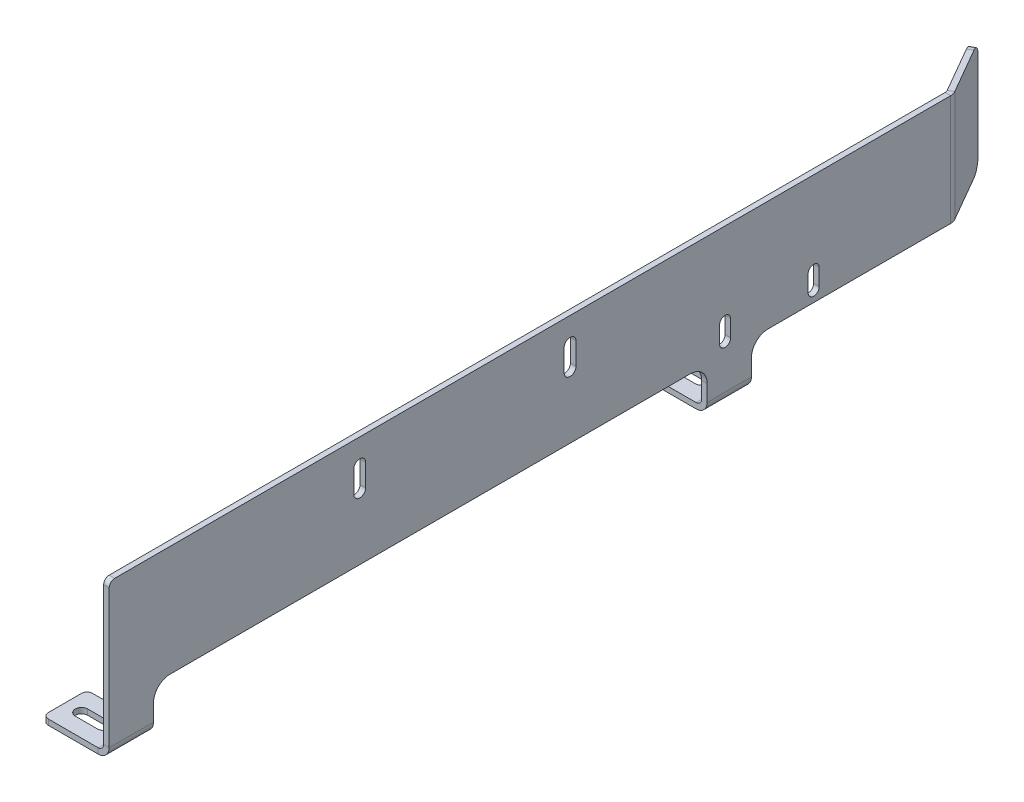
from build123d import *

# Parameters (mm, degrees)
BASE_FLANGE1_DEPTH             = 241.3
SKETCH7_W                      = 38.1
SKETCH7_H                      = 114.3
CUT_EXTRUDE2_DEPTH             = 25.4
EDGE_FLANGE1_DEPTH             = 63.5
FILLET2_R                      = 6.35
F_3_16_0_1875_DIAMETER_HOLE2_D = 4.7625
CUT_EXTRUDE1_REACH             = 293.504
CUT_EXTRUDE3_REACH             = 294.454
CUT_EXTRUDE4_REACH             = 294.454
SKETCH12_W                     = 317.5
SKETCH12_H                     = 25.4
FILLET1_R                      = 3.175
FILLET3_R                      = 9.525
CUT_EXTRUDE5_REACH             = 294.057


# Sheet-metal steps are written as plain solids
with BuildPart() as part:
    # Sketch1 → Base-Flange1 (new, symmetric)
    with BuildSketch(Plane.XY):
        with BuildLine():
            Line((0, 88.9), (0, 6.35))
            ThreePointArc((0, 6.35), (-1.859871939, 1.859871939), (-6.35, 0))
            Line((-6.35, 0), (-38.1, 0))
            Line((-38.1, 0), (-38.1, 3.175))
            Line((-38.1, 3.175), (-6.35, 3.175))
            ThreePointArc((-6.35, 3.175), (-4.10493597, 4.10493597), (-3.175, 6.35))
            Line((-3.175, 6.35), (-3.175, 88.9))
            Line((-3.175, 88.9), (0, 88.9))
        make_face()
    extrude(amount=BASE_FLANGE1_DEPTH, both=True)

    # Sketch7 → Cut-Extrude2 (cut)
    with BuildSketch(Plane.XZ):
        with Locations((-19.05, -184.15)):
            Rectangle(SKETCH7_W, SKETCH7_H)
    extrude(amount=-CUT_EXTRUDE2_DEPTH, mode=Mode.SUBTRACT)

    # Edge-Flange1 section (across the edge) → Edge-Flange1 (add)
    with BuildSketch(Plane(origin=(-3.175, 88.9, -242.150738686), x_dir=(-0.8660254037844416, 0, 0.49999999999999495), z_dir=(0, -1, 0))):
        with BuildLine():
            Line((-3.175, 0.850738686), (-3.175, 37.249261314))
            Line((-3.175, 37.249261314), (0, 37.249261314))
            Line((0, 37.249261314), (0, 0.850738686))
            ThreePointArc((0, 0.850738686), (0.108185502, 0.028988218), (0.425369343, -0.736761314))
            Line((0.425369343, -0.736761314), (-2.324261314, -2.324261314))
            ThreePointArc((-2.324261314, -2.324261314), (-2.958628997, -0.79276225), (-3.175, 0.850738686))
        make_face()
    extrude(amount=EDGE_FLANGE1_DEPTH)

    # Fillet2
    fillet2_edges = [part.edges().sort_by_distance(p)[0] for p in [
        (-20.424815329, 88.9, -275.203295256),
        (-20.424815329, 25.4, -275.203295256),
    ]]
    fillet(fillet2_edges, radius=FILLET2_R)

    # 3/16 (0.1875) Diameter Hole2 (through all)
    with Locations(Plane(origin=(0, 0, 0), x_dir=(0, 0, -1), z_dir=(1, 0, 0))):
        with Locations((111.91875, 36.5125), (162.71875, 36.5125)):
            Hole(F_3_16_0_1875_DIAMETER_HOLE2_D / 2)

    # Sketch5 → Cut-Extrude1 (cut, up to next)
    with BuildSketch(Plane(origin=(0, 3.175, 0), x_dir=(-1, 0, 0), z_dir=(0, 1, 0)), mode=Mode.PRIVATE) as cut_extrude1_sk1:
        with BuildLine():
            Line((28.575, -117.871875), (15.875, -117.871875))
            ThreePointArc((15.875, -117.871875), (12.303125, -114.3), (15.875, -110.728125))
            Line((15.875, -110.728125), (28.575, -110.728125))
            ThreePointArc((28.575, -110.728125), (32.146875, -114.3), (28.575, -117.871875))
        make_face()
    cut_extrude1_tool1 = extrude(cut_extrude1_sk1.sketch, amount=-CUT_EXTRUDE1_REACH, mode=Mode.PRIVATE) & part.part
    # Sketch5 → Cut-Extrude1 (cut, up to next)
    with BuildSketch(Plane(origin=(0, 3.175, 0), x_dir=(-1, 0, 0), z_dir=(0, 1, 0)), mode=Mode.PRIVATE) as cut_extrude1_sk2:
        with BuildLine():
            Line((28.575, 225.028125), (15.875, 225.028125))
            ThreePointArc((15.875, 225.028125), (12.303125, 228.6), (15.875, 232.171875))
            Line((15.875, 232.171875), (28.575, 232.171875))
            ThreePointArc((28.575, 232.171875), (32.146875, 228.6), (28.575, 225.028125))
        make_face()
    cut_extrude1_tool2 = extrude(cut_extrude1_sk2.sketch, amount=-CUT_EXTRUDE1_REACH, mode=Mode.PRIVATE) & part.part
    add(cut_extrude1_tool1.solids().sort_by_distance((-22.225, 3.175, -114.3))[0], mode=Mode.SUBTRACT)
    add(cut_extrude1_tool2.solids().sort_by_distance((-22.225, 3.175, 228.6))[0], mode=Mode.SUBTRACT)

    # Sketch11 → Cut-Extrude3 (cut, up to next)
    with BuildSketch(Plane(origin=(0, 0, 0), x_dir=(0, 0, -1), z_dir=(1, 0, 0)), mode=Mode.PRIVATE) as cut_extrude3_sk1:
        with BuildLine():
            Line((115.09375, 41.275), (115.09375, 31.75))
            ThreePointArc((115.09375, 31.75), (111.91875, 28.575), (108.74375, 31.75))
            Line((108.74375, 31.75), (108.74375, 41.275))
            ThreePointArc((108.74375, 41.275), (111.91875, 44.45), (115.09375, 41.275))
        make_face()
    cut_extrude3_tool1 = extrude(cut_extrude3_sk1.sketch, amount=-CUT_EXTRUDE3_REACH, mode=Mode.PRIVATE) & part.part
    # Sketch11 → Cut-Extrude3 (cut, up to next)
    with BuildSketch(Plane(origin=(0, 0, 0), x_dir=(0, 0, -1), z_dir=(1, 0, 0)), mode=Mode.PRIVATE) as cut_extrude3_sk2:
        with BuildLine():
            Line((165.89375, 41.275), (165.89375, 31.75))
            ThreePointArc((165.89375, 31.75), (162.71875, 28.575), (159.54375, 31.75))
            Line((159.54375, 31.75), (159.54375, 41.275))
            ThreePointArc((159.54375, 41.275), (162.71875, 44.45), (165.89375, 41.275))
        make_face()
    cut_extrude3_tool2 = extrude(cut_extrude3_sk2.sketch, amount=-CUT_EXTRUDE3_REACH, mode=Mode.PRIVATE) & part.part
    add(cut_extrude3_tool1.solids().sort_by_distance((0, 36.5125, -111.91875))[0], mode=Mode.SUBTRACT)
    add(cut_extrude3_tool2.solids().sort_by_distance((0, 36.5125, -162.71875))[0], mode=Mode.SUBTRACT)

    # Sketch12 → Cut-Extrude4 (cut, up to next)
    with BuildSketch(Plane(origin=(0, 0, 0), x_dir=(0, 0, -1), z_dir=(1, 0, 0)), mode=Mode.PRIVATE) as cut_extrude4_sk1:
        with Locations((-57.15, 12.7)):
            Rectangle(SKETCH12_W, SKETCH12_H)
    cut_extrude4_tool1 = extrude(cut_extrude4_sk1.sketch, amount=-CUT_EXTRUDE4_REACH, mode=Mode.PRIVATE) & part.part
    add(cut_extrude4_tool1.solids().sort_by_distance((0, 12.7, 57.15))[0], mode=Mode.SUBTRACT)

    # Fillet1
    fillet1_edges = [part.edges().sort_by_distance(p)[0] for p in [
        (-38.1, 1.5875, 215.9),
        (-38.1, 1.5875, -101.6),
        (-1.5875, 88.9, 241.3),
        (-38.1, 1.5875, -127),
        (-38.1, 1.5875, 241.3),
    ]]
    fillet(fillet1_edges, radius=FILLET1_R)

    # Fillet3
    fillet3_edges = [part.edges().sort_by_distance(p)[0] for p in [
        (-1.5875, 25.4, 215.9),
        (-1.5875, 25.4, -101.6),
        (-1.5875, 25.4, -127),
    ]]
    fillet(fillet3_edges, radius=FILLET3_R)

    # Sketch13 → Cut-Extrude5 (cut, up to next)
    with BuildSketch(Plane.ZY.offset(3.175), mode=Mode.PRIVATE) as cut_extrude5_sk1:
        with BuildLine():
            Line((-19.64055, 74.6125), (-19.64055, 61.9125))
            ThreePointArc((-19.64055, 61.9125), (-23.01875, 58.5343), (-26.39695, 61.9125))
            Line((-26.39695, 61.9125), (-26.39695, 74.6125))
            ThreePointArc((-26.39695, 74.6125), (-23.01875, 77.9907), (-19.64055, 74.6125))
        make_face()
    cut_extrude5_tool1 = extrude(cut_extrude5_sk1.sketch, amount=-CUT_EXTRUDE5_REACH, mode=Mode.PRIVATE) & part.part
    # Sketch13 → Cut-Extrude5 (cut, up to next)
    with BuildSketch(Plane.ZY.offset(3.175), mode=Mode.PRIVATE) as cut_extrude5_sk2:
        with BuildLine():
            Line((101.00945, 74.6125), (101.00945, 61.9125))
            ThreePointArc((101.00945, 61.9125), (97.63125, 58.5343), (94.25305, 61.9125))
            Line((94.25305, 61.9125), (94.25305, 74.6125))
            ThreePointArc((94.25305, 74.6125), (97.63125, 77.9907), (101.00945, 74.6125))
        make_face()
    cut_extrude5_tool2 = extrude(cut_extrude5_sk2.sketch, amount=-CUT_EXTRUDE5_REACH, mode=Mode.PRIVATE) & part.part
    add(cut_extrude5_tool1.solids().sort_by_distance((-3.175, 68.2625, -23.01875))[0], mode=Mode.SUBTRACT)
    add(cut_extrude5_tool2.solids().sort_by_distance((-3.175, 68.2625, 97.63125))[0], mode=Mode.SUBTRACT)


solid = part.part
